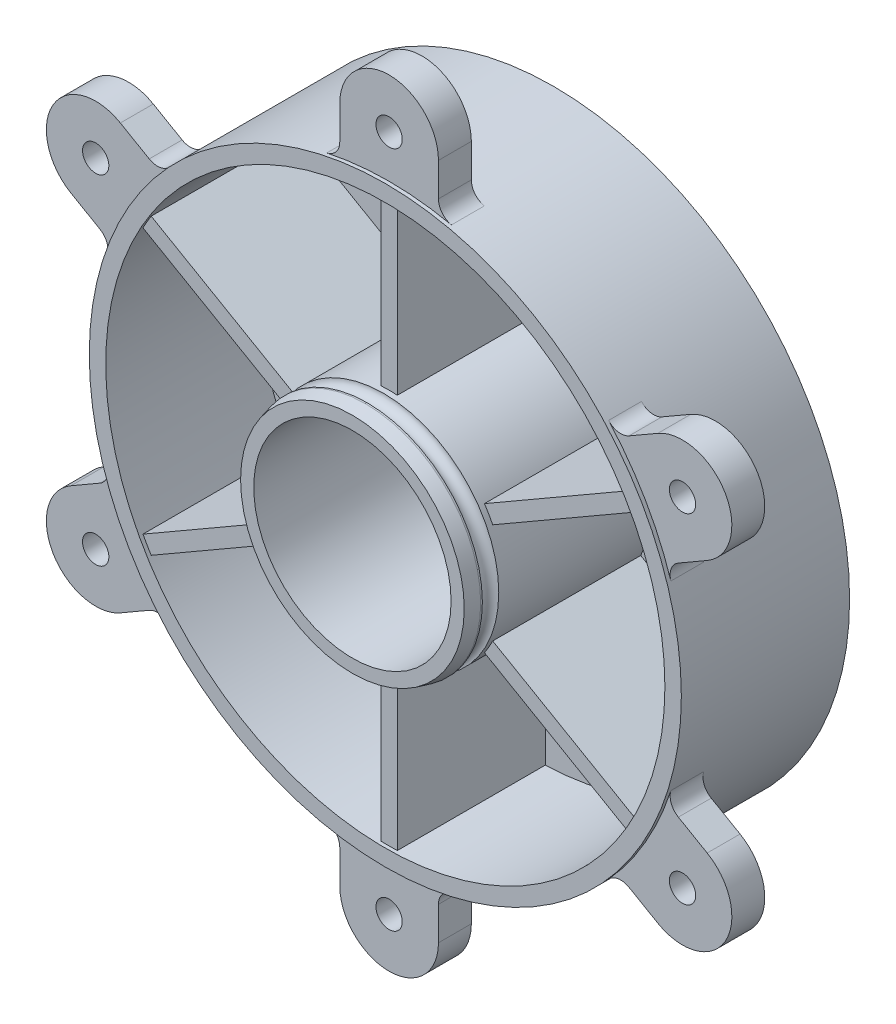
from build123d import *

# Parameters (mm, degrees)
IZIM2_R                        = 90
Y_KSEKLIK_EKSTR_ZYON1_DEPTH    = 51.153171198
IZIM3_R                        = 30
KES_EKSTR_ZYON1_DEPTH          = 138.17378366
BO_ALTMA1_T                    = -5
EKSTR_ZYON_NCE1_START          = 10
IZIM4_R                        = 35
IZIM4_R_2                      = 30
EKSTR_ZYON_NCE1_DEPTH          = 10
IZIM7_W                        = 45
IZIM7_H                        = 52.01571183
Y_KSEKLIK_EKSTR_ZYON6_DEPTH    = 2.5
IZIM11_R                       = 4
Y_KSEKLIK_EKSTR_ZYON7_DEPTH    = 10
DAIRESEL_KAPLAMA1_COUNT        = 6
RADYUS1_R                      = 5
DAIRESEL_KAPLAMA2_COUNT        = 6
RADYUS1_OF_DAIRESEL_KAPLAMA2_R = 5
PAH1_SIZE                      = 4
PAH1_SIZE2                     = 1
IZIM12_R                       = 2.49


with BuildPart() as part:
    # Çizim2 → Yükseklik-Ekstrüzyon1 (new body)
    with BuildSketch(Plane.XY):
        Circle(IZIM2_R)
    extrude(amount=Y_KSEKLIK_EKSTR_ZYON1_DEPTH)

    # Çizim3 → Kes-Ekstrüzyon1 (cut, through all)
    with BuildSketch(Plane.XY.offset(51.153171198)):
        Circle(IZIM3_R)
    extrude(amount=-KES_EKSTR_ZYON1_DEPTH, mode=Mode.SUBTRACT)

    # İç Boşaltma1
    bo_altma1_openings = [part.faces().sort_by_distance(p)[0] for p in [
        (-87.454415588, 0, 51.153171198),
    ]]
    offset(amount=BO_ALTMA1_T, openings=bo_altma1_openings, kind=Kind.INTERSECTION)

    # Çizim4 → Ekstrüzyon-İnce1 (add)
    with BuildSketch(Plane.XY.offset(51.153171198).offset(EKSTR_ZYON_NCE1_START)):
        Circle(IZIM4_R)
        Circle(IZIM4_R_2, mode=Mode.SUBTRACT)
    extrude(amount=-EKSTR_ZYON_NCE1_DEPTH)

    # Çizim7 → Yükseklik-Ekstrüzyon6 (add, symmetric)
    with BuildSketch(Plane(origin=(0, 0, 0), x_dir=(0, 0, -1), z_dir=(1, 0, 0))):
        with Locations((-27.5, 58.992144085)):
            Rectangle(IZIM7_W, IZIM7_H)
    y_kseklik_ekstr_zyon6 = extrude(amount=Y_KSEKLIK_EKSTR_ZYON6_DEPTH, both=True)

    # Çizim11 → Yükseklik-Ekstrüzyon7 (add)
    with BuildSketch(Plane.XY.offset(50)):
        with BuildLine():
            Line((-15, 103), (-15, 88.741196746))
            ThreePointArc((-15, 88.741196746), (0, 87.422001068), (15, 88.741196746))
            Line((15, 88.741196746), (15, 103))
            ThreePointArc((15, 103), (0, 118), (-15, 103))
        make_face()
        with Locations((0, 103)):
            Circle(IZIM11_R, mode=Mode.SUBTRACT)
    y_kseklik_ekstr_zyon7 = extrude(amount=-Y_KSEKLIK_EKSTR_ZYON7_DEPTH)

    # Dairesel Kaplama1: Yükseklik-Ekstrüzyon6 ×6 about axis
    dairesel_kaplama1_axis = Axis((0, 0, 0), (0, 0, -1))
    for i in range(1, DAIRESEL_KAPLAMA1_COUNT):
        add(y_kseklik_ekstr_zyon6.rotate(dairesel_kaplama1_axis, i * 360 / DAIRESEL_KAPLAMA1_COUNT))

    # Radyus1
    radyus1_edges = [part.edges().sort_by_distance(p)[0] for p in [
        (15, 88.741196746, 45),
        (-15, 88.741196746, 45),
    ]]
    fillet(radyus1_edges, radius=RADYUS1_R)

    # Dairesel Kaplama2: Yükseklik-Ekstrüzyon7 ×6 about axis
    dairesel_kaplama2_axis = Axis((0, 0, 51.153171198), (0, 0, -1))
    for i in range(1, DAIRESEL_KAPLAMA2_COUNT):
        add(y_kseklik_ekstr_zyon7.rotate(dairesel_kaplama2_axis, i * 360 / DAIRESEL_KAPLAMA2_COUNT))

    # Radyus1 of Dairesel Kaplama2
    radyus1_of_dairesel_kaplama2_edges = [part.edges().sort_by_distance(p)[0] for p in [
        (84.352130745, 31.380217316, 45),
        (69.352130745, 57.36097943, 45),
        (69.352130745, -57.36097943, 45),
        (84.352130745, -31.380217316, 45),
        (-15, -88.741196746, 45),
        (15, -88.741196746, 45),
        (-84.352130745, -31.380217316, 45),
        (-69.352130745, -57.36097943, 45),
        (-69.352130745, 57.36097943, 45),
        (-84.352130745, 31.380217316, 45),
    ]]
    fillet(radyus1_of_dairesel_kaplama2_edges, radius=RADYUS1_OF_DAIRESEL_KAPLAMA2_R)

    # Pah1
    pah1_edges = [part.edges().sort_by_distance(p)[0] for p in [
        (-35, 0, 61.153171198),
    ]]
    pah1_side = [part.faces().sort_by_distance(p)[0] for p in [
        (-35, 0, 33.076585599),
    ]]
    chamfer(pah1_edges, length=PAH1_SIZE, length2=PAH1_SIZE2, reference=pah1_side[0])

    # Çizim12 → Kes-Döndür1 (revolve, cut)
    with BuildSketch(Plane(origin=(0, 0, 0), x_dir=(0, 0, -1), z_dir=(1, 0, 0))):
        with Locations((-54.153171198, 35)):
            Circle(IZIM12_R)
    revolve(axis=Axis((0, 0, 0), (0, 0, 1)), mode=Mode.SUBTRACT)


solid = part.part
